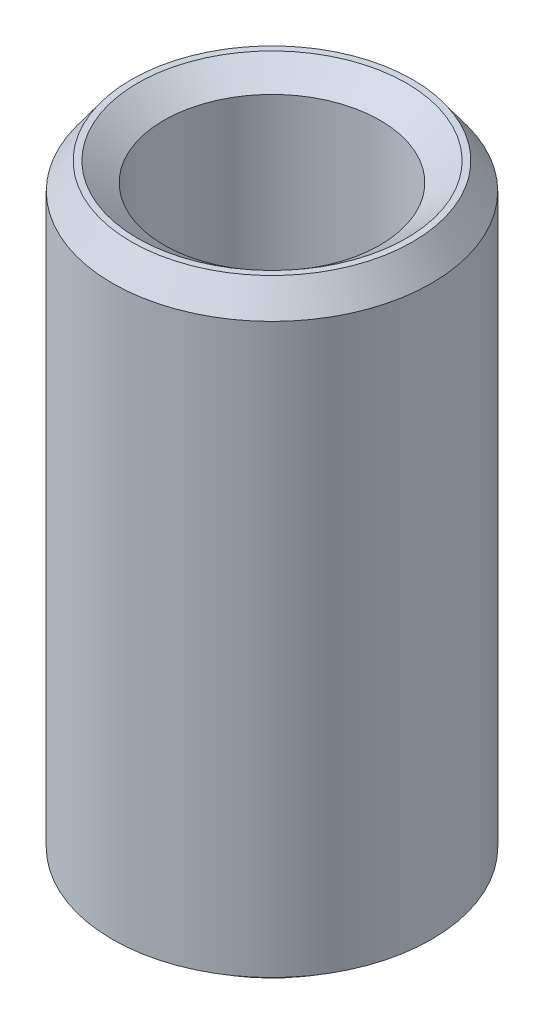
from build123d import *
from OCP.BRepFilletAPI import BRepFilletAPI_MakeChamfer

# Parameters (mm, degrees)
SKETCH1_R           = 12.5
BOSS_EXTRUDE1_DEPTH = 48.046373722
SKETCH2_R           = 8.465358442
CUT_EXTRUDE1_DEPTH  = 52.195253958
CHAMFER1_SIZE       = 2.061825996
CHAMFER1_SIZE2      = 1.488110523


with BuildPart() as part:
    # Sketch1 → Boss-Extrude1 (new body)
    with BuildSketch(Plane(origin=(0, 0, 0), x_dir=(1, 0, 0), z_dir=(0, 1, 0))):
        Circle(SKETCH1_R)
    extrude(amount=BOSS_EXTRUDE1_DEPTH)

    # Sketch2 → Cut-Extrude1 (cut, through all)
    with BuildSketch(Plane(origin=(0, 0, 0), x_dir=(1, 0, 0), z_dir=(0, 1, 0))):
        Circle(SKETCH2_R)
    extrude(amount=CUT_EXTRUDE1_DEPTH, mode=Mode.SUBTRACT)

    # Chamfer1: one chamfer whose edges measure the first distance from different faces: ONE call of the kernel's chamfer builder (chamfer() names one face for all edges)
    chamfer1_edges_1 = [part.edges().sort_by_distance(p)[0] for p in [
        (-8.465358442, 48.046373722, 0),
    ]]
    chamfer1_side_1 = [part.faces().sort_by_distance(p)[0] for p in [
        (-12.146446609, 48.046373722, 0),
    ]]
    chamfer1_edges_2 = [part.edges().sort_by_distance(p)[0] for p in [
        (-8.465358442, 0, 0),
    ]]
    chamfer1_side_2 = [part.faces().sort_by_distance(p)[0] for p in [
        (-8.465358442, 24.023186861, 0),
    ]]
    chamfer1_edges_3 = [part.edges().sort_by_distance(p)[0] for p in [
        (-12.5, 0, 0),
    ]]
    chamfer1_side_3 = [part.faces().sort_by_distance(p)[0] for p in [
        (-12.146446609, 0, 0),
    ]]
    chamfer1_edges_4 = [part.edges().sort_by_distance(p)[0] for p in [
        (-12.5, 48.046373722, 0),
    ]]
    chamfer1_side_4 = [part.faces().sort_by_distance(p)[0] for p in [
        (-12.5, 24.023186861, 0),
    ]]
    chamfer1 = BRepFilletAPI_MakeChamfer(part.part.solid().wrapped)
    for e in chamfer1_edges_1:
        chamfer1.Add(CHAMFER1_SIZE, CHAMFER1_SIZE2, e.wrapped, chamfer1_side_1[0].wrapped)  # the first distance lies on this face
    for e in chamfer1_edges_2:
        chamfer1.Add(CHAMFER1_SIZE, CHAMFER1_SIZE2, e.wrapped, chamfer1_side_2[0].wrapped)  # the first distance lies on this face
    for e in chamfer1_edges_3:
        chamfer1.Add(CHAMFER1_SIZE, CHAMFER1_SIZE2, e.wrapped, chamfer1_side_3[0].wrapped)  # the first distance lies on this face
    for e in chamfer1_edges_4:
        chamfer1.Add(CHAMFER1_SIZE, CHAMFER1_SIZE2, e.wrapped, chamfer1_side_4[0].wrapped)  # the first distance lies on this face
    add(Compound.cast(chamfer1.Shape()), mode=Mode.REPLACE)


solid = part.part
